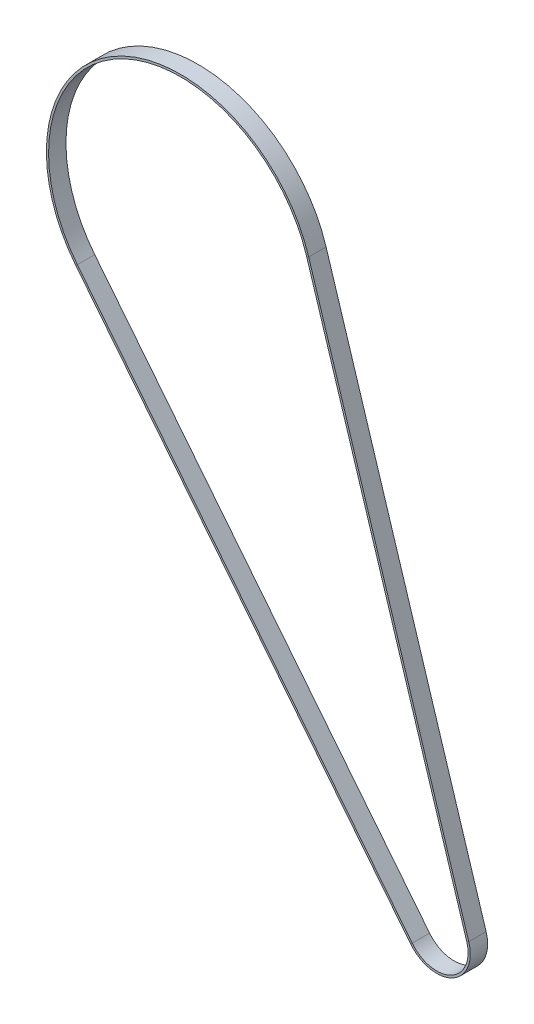
from build123d import *

# Parameters (mm, degrees)
SKETCH3_W = 0.5
SKETCH3_H = 4.023685774


with BuildPart() as part:
    # Sweep1: sweep along a path in Sketch2
    with BuildLine(Plane.XY) as sweep1_path:
        Line((30.160708029, 80.222314342), (67.172425062, -38.407055635))
        ThreePointArc((67.172425062, -38.407055635), (63.521274909, -47.280363147), (54.127317177, -45.325870429))
        Line((54.127317177, -45.325870429), (-23.322236008, 51.856233531))
        ThreePointArc((-23.322236008, 51.856233531), (-13.668195257, 98.256841684), (30.160708029, 80.222314342))
    # Sketch3 → Sweep1 (sweep)
    with BuildSketch(Plane(origin=(54.127317177, -45.325870429, 0), x_dir=(0.7820298842379602, 0.6232409326727205, 0), z_dir=(-0.6232409326727206, 0.7820298842379603, 0))):
        with Locations((0.006833178, 0)):
            Rectangle(SKETCH3_W, SKETCH3_H)
    sweep(path=sweep1_path.line)


solid = part.part
